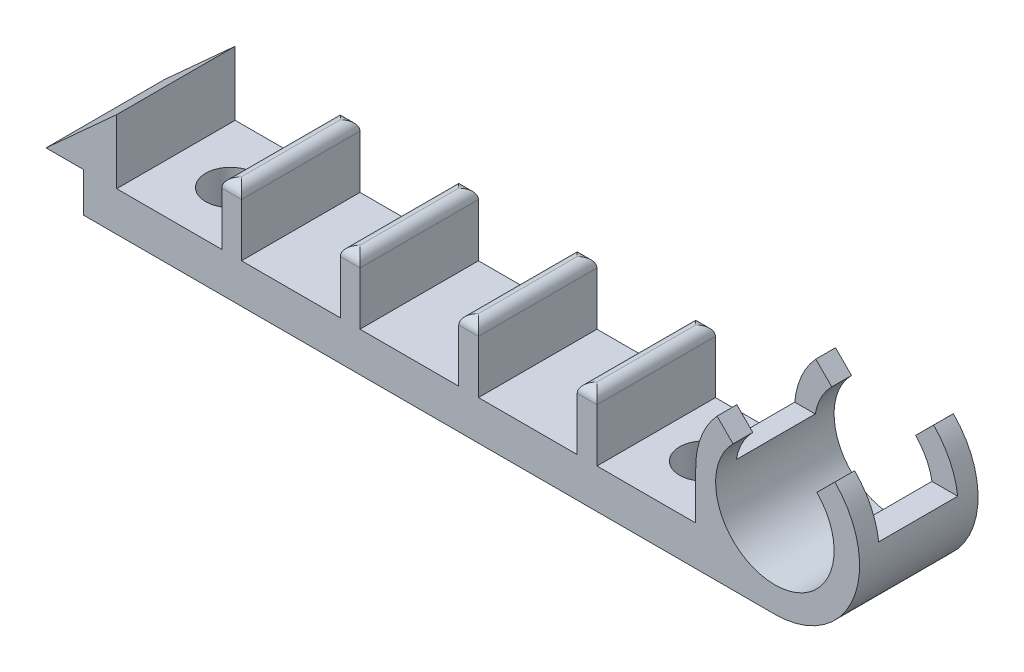
from build123d import *

# Parameters (mm, degrees)
BOSS_EXTRU_1_DEPTH      = 12
ESQUISSE2_R             = 6
ENL_V_MAT_EXTRU_1_DEPTH = 12
ESQUISSE5_W             = 22.19086736
ESQUISSE5_H             = 9.756409295
ENL_V_MAT_EXTRU_2_DEPTH = 8
ENL_V_MAT_EXTRU_3_DEPTH = 60.309125122
CONG_1_R                = 1
ESQUISSE7_R             = 2.5
ENL_V_MAT_EXTRU_4_DEPTH = 4


with BuildPart() as part:
    # Esquisse1 → Boss.-Extru.1 (new body)
    with BuildSketch(Plane.XY):
        with BuildLine():
            Line((-48.320645407, 10.526434737), (-55.480460412, 4.026434737))
            Line((-55.480460412, 4.026434737), (-51.660830402, 4.026434737))
            Line((-51.660830402, 4.026434737), (-51.660830402, 0.026434737))
            Line((-51.660830402, 0.026434737), (18.339169598, 0.026434737))
            ThreePointArc((18.339169598, 0.026434737), (26.920875662, 8.608140801), (18.339169598, 17.189846865))
            ThreePointArc((18.339169598, 17.189846865), (12.553618084, 14.559253744), (10.32272561, 8.608140801))
            Line((10.32272561, 8.608140801), (10.32272561, 4.026434737))
            Line((10.32272561, 4.026434737), (0.32272561, 4.026434737))
            Line((0.32272561, 4.026434737), (0.32272561, 10.398479958))
            Line((0.32272561, 10.398479958), (-1.67727439, 10.398479958))
            Line((-1.67727439, 10.398479958), (-1.67727439, 4.026434737))
            Line((-1.67727439, 4.026434737), (-11.67727439, 4.026434737))
            Line((-11.67727439, 4.026434737), (-11.67727439, 10.398479958))
            Line((-11.67727439, 10.398479958), (-13.67727439, 10.398479958))
            Line((-13.67727439, 10.398479958), (-13.67727439, 4.026434737))
            Line((-13.67727439, 4.026434737), (-23.67727439, 4.026434737))
            Line((-23.67727439, 4.026434737), (-23.67727439, 10.398479958))
            Line((-23.67727439, 10.398479958), (-25.67727439, 10.398479958))
            Line((-25.67727439, 10.398479958), (-25.67727439, 4.026434737))
            Line((-25.67727439, 4.026434737), (-35.67727439, 4.026434737))
            Line((-35.67727439, 4.026434737), (-35.67727439, 10.398479958))
            Line((-35.67727439, 10.398479958), (-37.67727439, 10.398479958))
            Line((-37.67727439, 10.398479958), (-37.67727439, 4.026434737))
            Line((-37.67727439, 4.026434737), (-44.980460412, 4.026434737))
            Line((-44.980460412, 4.026434737), (-48.320645407, 4.026434737))
            Line((-48.320645407, 4.026434737), (-48.320645407, 10.526434737))
        make_face()
    extrude(amount=BOSS_EXTRU_1_DEPTH)

    # Esquisse2 → Enlèv. mat.-Extru.1 (cut)
    with BuildSketch(Plane.XY.offset(12)):
        with Locations((18.339169598, 8.608140801)):
            Circle(ESQUISSE2_R)
    extrude(amount=-ENL_V_MAT_EXTRU_1_DEPTH, mode=Mode.SUBTRACT)

    # Esquisse5 → Enlèv. mat.-Extru.2 (cut)
    with BuildSketch(Plane.XY.offset(2)):
        with Locations((18.196730475, 14.519832028)):
            Rectangle(ESQUISSE5_W, ESQUISSE5_H)
    extrude(amount=ENL_V_MAT_EXTRU_2_DEPTH, mode=Mode.SUBTRACT)

    # Esquisse6 → Enlèv. mat.-Extru.3 (cut, through all)
    with BuildSketch(Plane.XY):
        Polygon((6.09054696, 20.904289339), (18.339169598, 8.608140801), (30.683028441, 20.904289339), align=None)
    extrude(amount=ENL_V_MAT_EXTRU_3_DEPTH, mode=Mode.SUBTRACT)

    # Congé1
    cong_1_edges = [part.edges().sort_by_distance(p)[0] for p in [
        (-36.67727439, 10.398479958, 0),
        (-0.67727439, 10.398479958, 12),
        (-24.67727439, 10.398479958, 0),
        (-12.67727439, 10.398479958, 0),
        (-0.67727439, 10.398479958, 0),
        (-12.67727439, 10.398479958, 12),
        (-37.67727439, 10.398479958, 6),
        (-35.67727439, 10.398479958, 6),
        (-25.67727439, 10.398479958, 6),
        (-23.67727439, 10.398479958, 6),
        (-13.67727439, 10.398479958, 6),
        (-11.67727439, 10.398479958, 6),
        (-1.67727439, 10.398479958, 6),
        (0.32272561, 10.398479958, 6),
        (-24.67727439, 10.398479958, 12),
        (-36.67727439, 10.398479958, 12),
    ]]
    fillet(cong_1_edges, radius=CONG_1_R - 0.0001)  # a hair under: the kernel refuses the full size

    # Esquisse7 → Enlèv. mat.-Extru.4 (cut)
    with BuildSketch(Plane(origin=(0, 4.026434737, 0), x_dir=(1, 0, 0), z_dir=(0, 1, 0))):
        with Locations(Location((-42.67727439, -6.1321655, 0), (0, 0, 180))):
            Circle(ESQUISSE7_R)
        with Locations(Location((5.32272561, -6.1321655, 0), (0, 0, 180))):
            Circle(ESQUISSE7_R)
    extrude(amount=-ENL_V_MAT_EXTRU_4_DEPTH, mode=Mode.SUBTRACT)


solid = part.part
